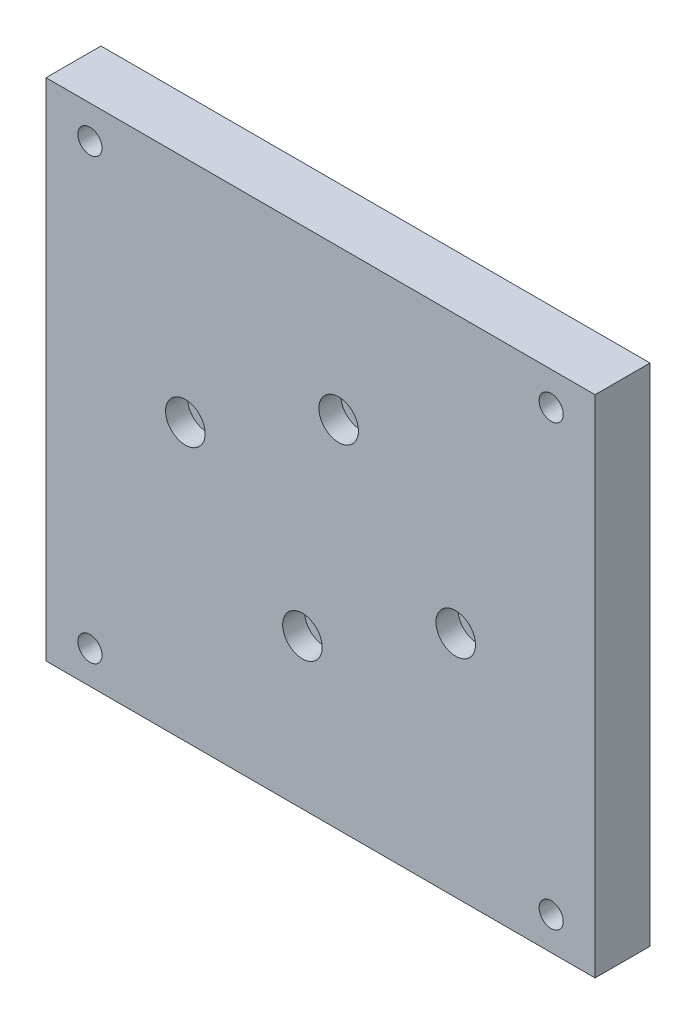
from build123d import *

# Parameters (mm, degrees)
SKETCH_1_W          = 50
SKETCH_1_H          = 46
EXTRUDE_1_DEPTH     = 5
SKETCH_2_R          = 1.025
CUT_EXTRUDE_1_DEPTH = 5
SKETCH_3_R          = 1.8
CUT_EXTRUDE_2_DEPTH = 2
SKETCH_4_R          = 1.1
CUT_EXTRUDE_3_DEPTH = 24


with BuildPart() as part:
    # 草图1 → 凸台-拉伸1 (new body)
    with BuildSketch(Plane.XY):
        Rectangle(SKETCH_1_W, SKETCH_1_H)
    extrude(amount=EXTRUDE_1_DEPTH)

    # 草图2 → 切除-拉伸1 (cut)
    with BuildSketch(Plane.XY.offset(5)):
        with Locations((-1.649657688, -9.355673654)):
            Circle(SKETCH_2_R)
        with Locations((12.310096913, -2.170602221)):
            Circle(SKETCH_2_R)
        with Locations((1.649657688, 9.355673654)):
            Circle(SKETCH_2_R)
        with Locations((-12.310096913, 2.170602221)):
            Circle(SKETCH_2_R)
    extrude(amount=-CUT_EXTRUDE_1_DEPTH, mode=Mode.SUBTRACT)

    # 草图3 → 切除-拉伸2 (cut)
    with BuildSketch(Plane.XY.offset(5)):
        with Locations((-12.310096913, 2.170602221)):
            Circle(SKETCH_3_R)
        with Locations((1.649657688, 9.355673654)):
            Circle(SKETCH_3_R)
        with Locations((12.310096913, -2.170602221)):
            Circle(SKETCH_3_R)
        with Locations((-1.649657688, -9.355673654)):
            Circle(SKETCH_3_R)
    extrude(amount=-CUT_EXTRUDE_2_DEPTH, mode=Mode.SUBTRACT)

    # 草图4 → 切除-拉伸3 (cut)
    with BuildSketch(Plane(origin=(0, 0, 0), x_dir=(-1, 0, 0), z_dir=(0, 0, -1))):
        with Locations((21, -20)):
            Circle(SKETCH_4_R)
        with Locations((-21, -20)):
            Circle(SKETCH_4_R)
    cut_extrude_3 = extrude(amount=-CUT_EXTRUDE_3_DEPTH, mode=Mode.SUBTRACT)

    # 镜向1: 切除-拉伸3 across plane
    add(cut_extrude_3.mirror(Plane(origin=(0, 0, 0), x_dir=(0, 0, 1), z_dir=(0, -1, 0))), mode=Mode.SUBTRACT)


solid = part.part
